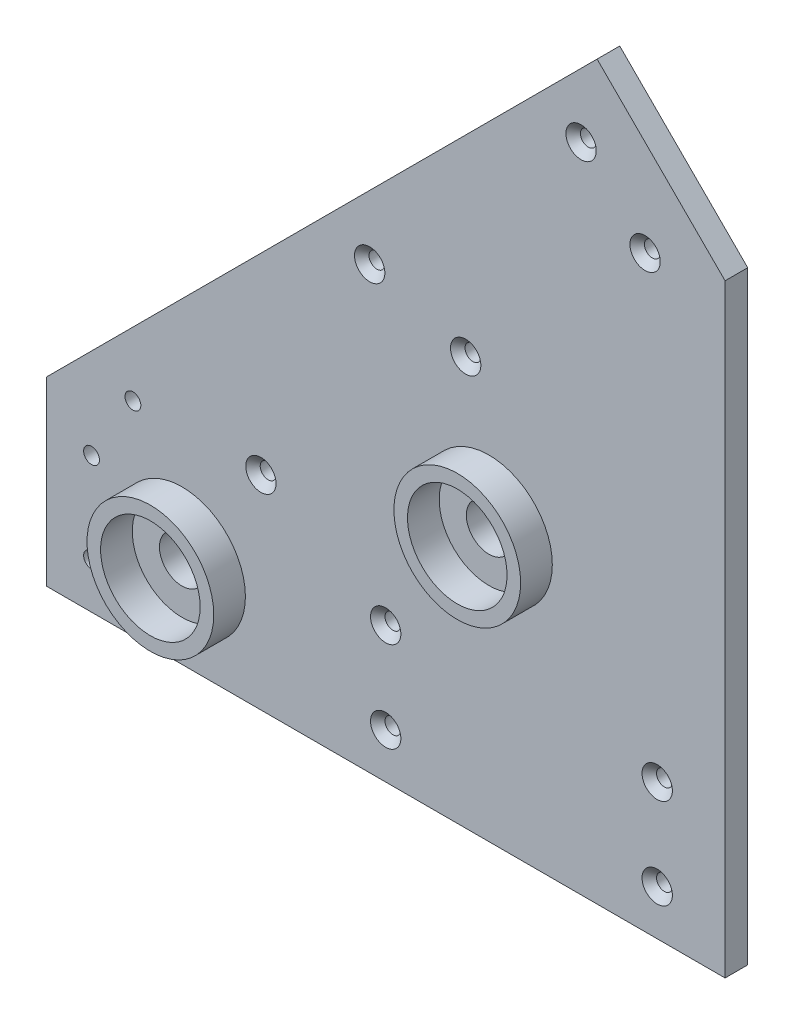
from build123d import *

# Parameters (mm, degrees)
SKETCH1_R           = 1.75
SKETCH1_R_2         = 5
SKETCH1_R_3         = 4.999999998
BOSS_EXTRUDE1_DEPTH = 5
SKETCH2_R           = 14
SKETCH2_R_2         = 11
SKETCH2_R_3         = 13.999999998
SKETCH2_R_4         = 10.999999998
BOSS_EXTRUDE2_DEPTH = 7
CHAMFER1_SIZE       = 1.6


with BuildPart() as part:
    # Sketch1 → Boss-Extrude1 (new body)
    with BuildSketch(Plane.XY):
        Polygon((46.715728753, 141.715728753), (-75, 20), (-75, -20), (75, -20), (75, 20), (75, 113.431457505), align=None)
        with Locations((-65, -10)):
            Circle(SKETCH1_R, mode=Mode.SUBTRACT)
        with Locations((-45, 0)):
            Circle(SKETCH1_R_2, mode=Mode.SUBTRACT)
        with Locations((-65, 10)):
            Circle(SKETCH1_R, mode=Mode.SUBTRACT)
        with Locations((0, 10)):
            Circle(SKETCH1_R, mode=Mode.SUBTRACT)
        with Locations((-55.857864376, 25)):
            Circle(SKETCH1_R, mode=Mode.SUBTRACT)
        with Locations((-27.573593129, 25)):
            Circle(SKETCH1_R, mode=Mode.SUBTRACT)
        with Locations((0, -10)):
            Circle(SKETCH1_R, mode=Mode.SUBTRACT)
        with Locations((60, -10)):
            Circle(SKETCH1_R, mode=Mode.SUBTRACT)
        with Locations((60, 10)):
            Circle(SKETCH1_R, mode=Mode.SUBTRACT)
        with Locations((22.819931216, 40)):
            Circle(SKETCH1_R_3, mode=Mode.SUBTRACT)
        with Locations((-3.535533906, 77.32233047)):
            Circle(SKETCH1_R, mode=Mode.SUBTRACT)
        with Locations((17.67766953, 70.251262658)):
            Circle(SKETCH1_R, mode=Mode.SUBTRACT)
        with Locations((57.32233047, 109.895923599)):
            Circle(SKETCH1_R, mode=Mode.SUBTRACT)
        with Locations((43.180194847, 124.038059223)):
            Circle(SKETCH1_R, mode=Mode.SUBTRACT)
    extrude(amount=BOSS_EXTRUDE1_DEPTH)

    # Sketch2 → Boss-Extrude2 (add)
    # profile 1 of 2: a face of its own
    with BuildSketch(Plane.XY.offset(5)):
        with Locations((-45, 0)):
            Circle(SKETCH2_R)
        with Locations((-45, 0)):
            Circle(SKETCH2_R_2, mode=Mode.SUBTRACT)
    # profile 2 of 2: a face of its own
    with BuildSketch(Plane.XY.offset(5)):
        with Locations((22.819931216, 40)):
            Circle(SKETCH2_R_3)
        with Locations((22.819931216, 40)):
            Circle(SKETCH2_R_4, mode=Mode.SUBTRACT)
    extrude(amount=BOSS_EXTRUDE2_DEPTH)

    # Chamfer1
    chamfer1_edges = [part.edges().sort_by_distance(p)[0] for p in [
        (-29.323593129, 25, 5),
        (58.25, -10, 5),
        (58.25, 10, 5),
        (-1.75, -10, 5),
        (-1.75, 10, 5),
        (15.92766953, 70.251262658, 5),
        (-5.285533906, 77.32233047, 5),
        (55.57233047, 109.895923599, 5),
        (41.430194847, 124.038059223, 5),
    ]]
    chamfer(chamfer1_edges, length=CHAMFER1_SIZE)


solid = part.part
